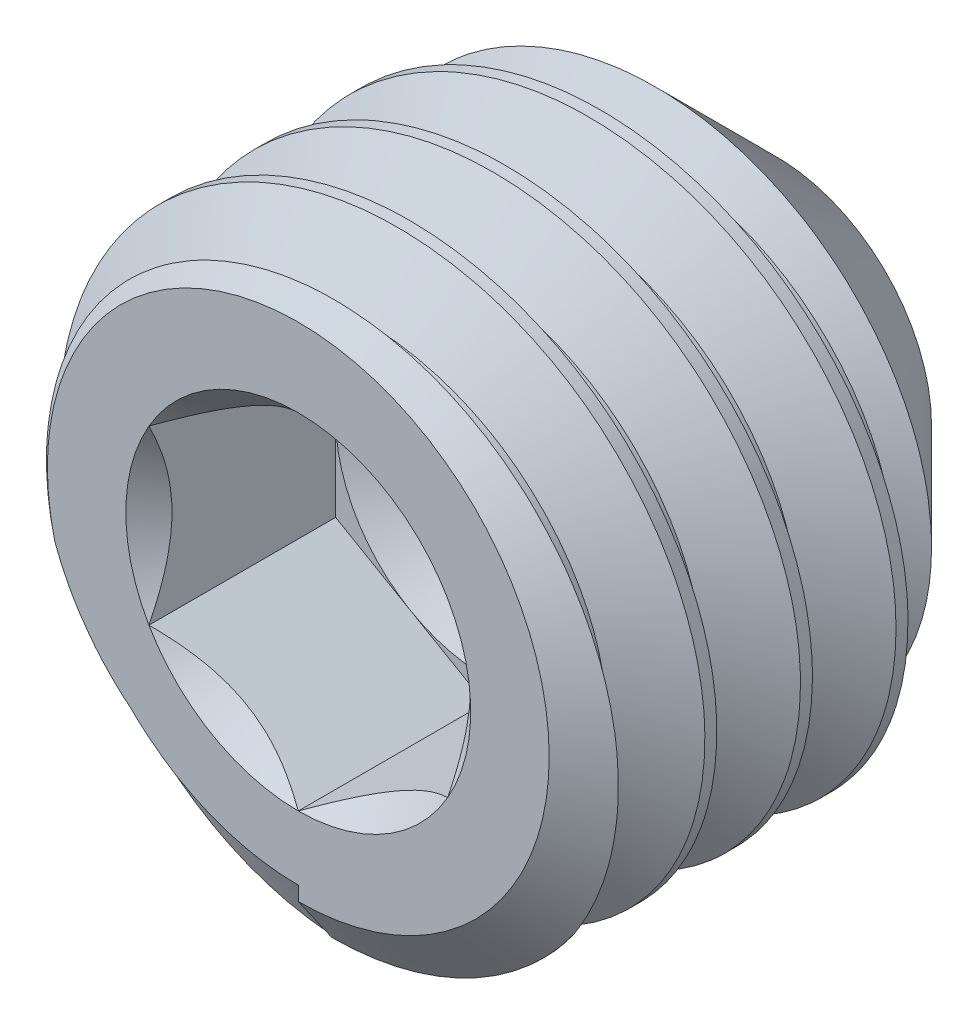
from build123d import *

# Parameters (mm, degrees)
CUT_EXTRUDE1_DEPTH = 1.5625
CUT_SWEEP1_PITCH   = 0.8


with BuildPart() as part:
    # Sketch11 → Revolve1 (revolve)
    with BuildSketch(Plane(origin=(0, 0, 0), x_dir=(0, 0, -1), z_dir=(1, 0, 0)), mode=Mode.PRIVATE) as revolve1_sk:
        Polygon((-2, 0), (-2, 2.1), (-1.719916985, 2.5), (0.8, 2.5), (2, 1.3), (1.218881195, 0), align=None)
    revolve(revolve1_sk.sketch.rotate(Axis((0, 0, -1.218881195), (0, 0, -1)), 90), axis=Axis((0, 0, -1.218881195), (0, 0, -1)))

    # Sketch2 → Cut-Extrude1 (cut)
    with BuildSketch(Plane.XY.offset(2)):
        Polygon((0, 1.443375673), (-1.25, 0.721687836), (-1.25, -0.721687836), (0, -1.443375673), (1.25, -0.721687836), (1.25, 0.721687836), align=None)
    extrude(amount=-CUT_EXTRUDE1_DEPTH, mode=Mode.SUBTRACT)

    # Cut-Extrude2 cone 1 section (through the dimple's axis) → Cut-Extrude2 (revolve, cut)
    with BuildSketch(Plane(origin=(0, 0, 2), x_dir=(0, -1, 0), z_dir=(1, 0, 0))):
        Polygon((0, 0), (1.443375673, 0), (0, 1.443375673), align=None)
    revolve(axis=Axis((0, 0, 2), (0, 0, -1)), mode=Mode.SUBTRACT)

    # Cut-Extrude3 cone 1 section (through the dimple's axis) → Cut-Extrude3 (revolve, cut)
    with BuildSketch(Plane(origin=(0, 0, 0.4375), x_dir=(0, -1, 0), z_dir=(1, 0, 0))):
        Polygon((0, 0), (1.25, 0), (0, 0.721687836), align=None)
    revolve(axis=Axis((0, 0, 0.4375), (0, 0, -1)), mode=Mode.SUBTRACT)

    # Cut-Sweep1: the profile of Sketch6 screwed along a right-hand helix of 5.5 turns, 8 arcs to a turn; built about Z, then put on its axis
    cut_sweep1_z = Axis((0, 0, 0), (0, 0, 1))
    cut_sweep1_corners = [(2.54330127, 0, 0.025), (2.54330127, 0, -0.725), (1.980384758, 0, -0.4), (1.980384758, 0, -0.3)]
    with BuildLine(mode=Mode.PRIVATE) as cut_sweep1_profile:
        Line(cut_sweep1_corners[0], cut_sweep1_corners[1])
        Line(cut_sweep1_corners[1], cut_sweep1_corners[2])
        Line(cut_sweep1_corners[2], cut_sweep1_corners[3])
        Line(cut_sweep1_corners[3], cut_sweep1_corners[0])
    cut_sweep1_cap = Face(cut_sweep1_profile.wire())
    cut_sweep1_turn_angles = [0, 22.5, 45, 67.5, 90, 112.5, 135, 157.5, 180, 202.5, 225, 247.5, 270, 292.5, 315, 337.5, 360]
    cut_sweep1_turn_weights = [1, 0.9238795325112867, 1, 0.9238795325112867, 1, 0.9238795325112867, 1, 0.9238795325112867, 1, 0.9238795325112867, 1, 0.9238795325112867, 1, 0.9238795325112867, 1, 0.9238795325112867, 1]
    cut_sweep1_turn_rails = [Edge.make_bspline([Vector(p[0], p[1], 0).rotate(cut_sweep1_z, cut_sweep1_turn_angles[k]) / cut_sweep1_turn_weights[k] + Vector(0, 0, p[2] + CUT_SWEEP1_PITCH * cut_sweep1_turn_angles[k] / 360) for k in range(17)], [0, 0, 0, 1, 1, 2, 2, 3, 3, 4, 4, 5, 5, 6, 6, 7, 7, 8, 8, 8], 2, cut_sweep1_turn_weights) for p in cut_sweep1_corners]
    cut_sweep1_turn_sides = [Face.make_surface_from_curves(cut_sweep1_turn_rails[p[0]], cut_sweep1_turn_rails[p[1]]) for p in [(0, 1), (1, 2), (2, 3), (3, 0)]]
    cut_sweep1_last_angles = [1800, 1822.5, 1845, 1867.5, 1890, 1912.5, 1935, 1957.5, 1980]
    cut_sweep1_last_weights = [1, 0.9238795325112867, 1, 0.9238795325112867, 1, 0.9238795325112867, 1, 0.9238795325112731, 1]
    cut_sweep1_last_rails = [Edge.make_bspline([Vector(p[0], p[1], 0).rotate(cut_sweep1_z, cut_sweep1_last_angles[k]) / cut_sweep1_last_weights[k] + Vector(0, 0, p[2] + CUT_SWEEP1_PITCH * cut_sweep1_last_angles[k] / 360) for k in range(9)], [0, 0, 0, 1, 1, 2, 2, 3, 3, 4, 4, 4], 2, cut_sweep1_last_weights) for p in cut_sweep1_corners]
    cut_sweep1_last_sides = [Face.make_surface_from_curves(cut_sweep1_last_rails[p[0]], cut_sweep1_last_rails[p[1]]) for p in [(0, 1), (1, 2), (2, 3), (3, 0)]]
    cut_sweep1 = Plane(origin=(0, 0, -2), x_dir=(0, 1, 0), z_dir=(0, 0, 1)) * Solid(Shell([*[p.moved(Location((0, 0, CUT_SWEEP1_PITCH * i))) for i in range(5) for p in cut_sweep1_turn_sides], *cut_sweep1_last_sides, cut_sweep1_cap, cut_sweep1_cap.rotate(cut_sweep1_z, 1980).moved(Location((0, 0, CUT_SWEEP1_PITCH * 1980 / 360)))]))
    add(cut_sweep1, mode=Mode.SUBTRACT)


solid = part.part
